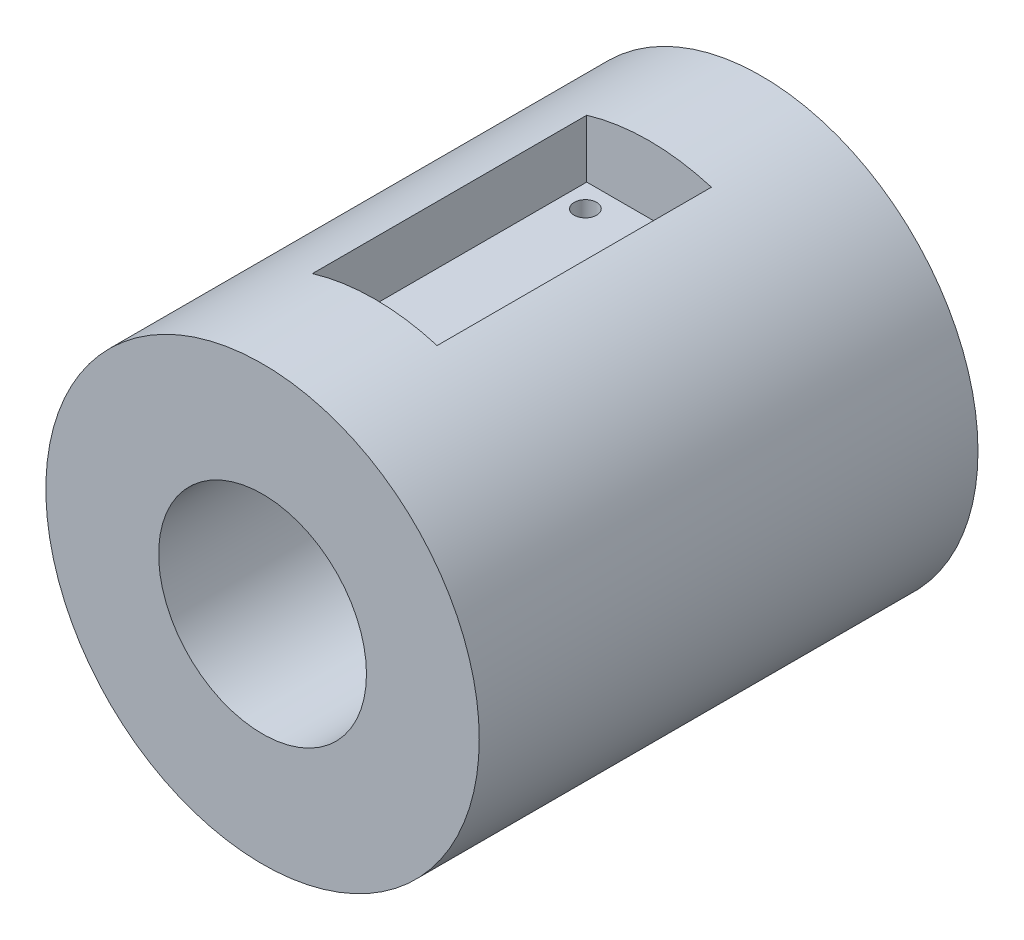
from build123d import *

# Parameters (mm, degrees)
ELECTRONICSBAYSKETCH_R      = 43.45
ELECTRONICSBAYSKETCH_R_2    = 20.8375
ELECTRONICSBAYEXTRUDE_DEPTH = 100
STRATOLOGGERSKETCH_W        = 25
STRATOLOGGERSKETCH_H        = 55
STRATOLOGGERCUT_DEPTH       = 132.464082547
HEATINSERTSKETCH_R          = 2.25
CUT_EXTRUDE2_DEPTH          = 6


with BuildPart() as part:
    # ElectronicsBaySketch → ElectronicsBayExtrude (new body)
    with BuildSketch(Plane.XY):
        Circle(ELECTRONICSBAYSKETCH_R)
        Circle(ELECTRONICSBAYSKETCH_R_2, mode=Mode.SUBTRACT)
    extrude(amount=ELECTRONICSBAYEXTRUDE_DEPTH)

    # StratoLoggerSketch → StratoLoggerCut (cut, through all)
    with BuildSketch(Plane(origin=(0, 30, 0), x_dir=(1, 0, 0), z_dir=(0, 1, 0))):
        with Locations((0, -50)):
            Rectangle(STRATOLOGGERSKETCH_W, STRATOLOGGERSKETCH_H)
    extrude(amount=STRATOLOGGERCUT_DEPTH, mode=Mode.SUBTRACT)

    # HeatInsertSketch → Cut-Extrude2 (cut)
    with BuildSketch(Plane(origin=(0, 30, 0), x_dir=(1, 0, 0), z_dir=(0, 1, 0))):
        with Locations((-8.001, -27.267)):
            Circle(HEATINSERTSKETCH_R)
        with Locations((8.001, -27.267)):
            Circle(HEATINSERTSKETCH_R)
        with Locations((8.001, -72.733)):
            Circle(HEATINSERTSKETCH_R)
        with Locations((-8.001, -72.733)):
            Circle(HEATINSERTSKETCH_R)
    extrude(amount=-CUT_EXTRUDE2_DEPTH, mode=Mode.SUBTRACT)


solid = part.part
